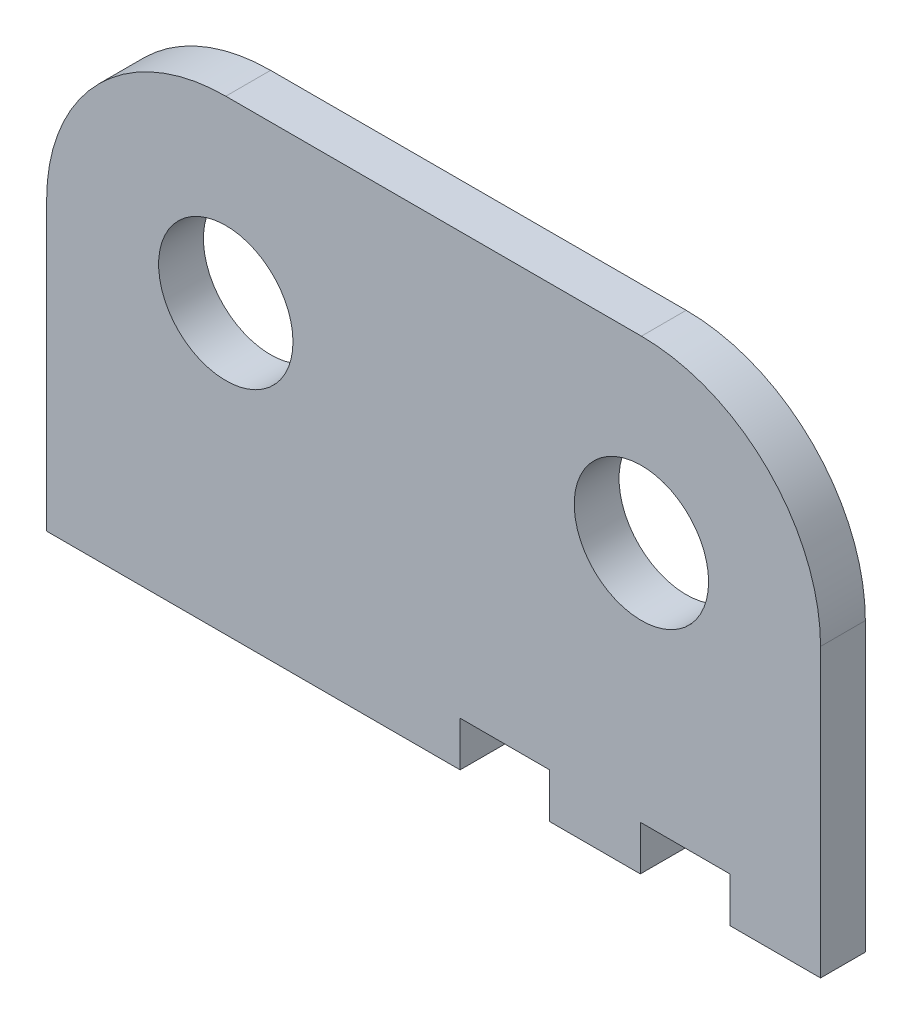
from build123d import *

# Parameters (mm, degrees)
SKETCH1_R           = 4.7625
BOSS_EXTRUDE1_DEPTH = 3.175
SKETCH2_W           = 6.35
SKETCH2_H           = 3.175
CUT_EXTRUDE1_DEPTH  = 3.175


with BuildPart() as part:
    # Sketch1 → Boss-Extrude1 (new body)
    with BuildSketch(Plane.XY):
        with BuildLine():
            Line((33.387675642, 20.35683), (33.387675642, 0))
            Line((33.387675642, 0), (-21.476324358, 0))
            Line((-21.476324358, 0), (-21.476324358, 20.35683))
            ThreePointArc((-21.476324358, 20.35683), (-17.756580479, 29.337086121), (-8.776324358, 33.05683))
            Line((-8.776324358, 33.05683), (20.687675642, 33.05683))
            ThreePointArc((20.687675642, 33.05683), (29.667931764, 29.337086121), (33.387675642, 20.35683))
        make_face()
        with Locations((20.687675642, 20.35683)):
            Circle(SKETCH1_R, mode=Mode.SUBTRACT)
        with Locations((-8.776324358, 20.35683)):
            Circle(SKETCH1_R, mode=Mode.SUBTRACT)
    extrude(amount=BOSS_EXTRUDE1_DEPTH)

    # Sketch2 → Cut-Extrude1 (cut)
    with BuildSketch(Plane.XZ):
        with Locations((23.786475642, 1.5875)):
            Rectangle(SKETCH2_W, SKETCH2_H)
        with Locations((11.010275642, 1.5875)):
            Rectangle(SKETCH2_W, SKETCH2_H)
    extrude(amount=-CUT_EXTRUDE1_DEPTH, mode=Mode.SUBTRACT)


solid = part.part
